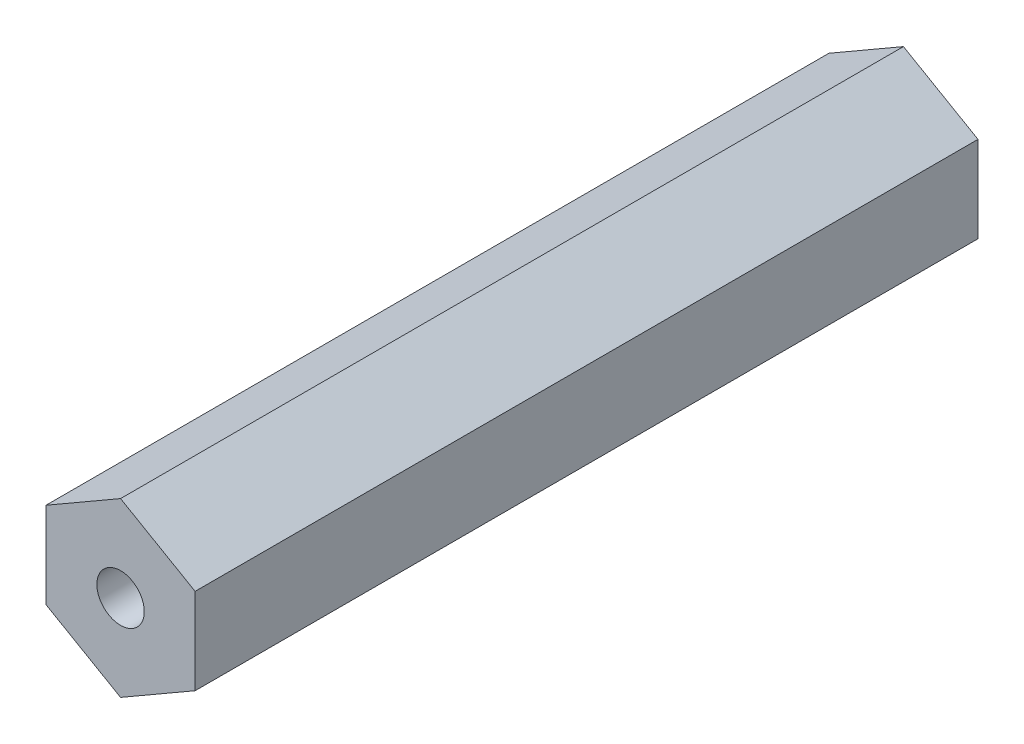
from build123d import *

# Parameters (mm, degrees)
BOSS_EXTRUDE1_DEPTH = 33.3375
SKETCH2_R           = 2.0193
CUT_EXTRUDE1_DEPTH  = 68.376861446


with BuildPart() as part:
    # Sketch1 → Boss-Extrude1 (new, symmetric)
    with BuildSketch(Plane.XY):
        Polygon((0, 7.332348419), (-6.35, 3.666174209), (-6.35, -3.666174209), (0, -7.332348419), (6.35, -3.666174209), (6.35, 3.666174209), align=None)
    extrude(amount=BOSS_EXTRUDE1_DEPTH, both=True)

    # Sketch2 → Cut-Extrude1 (cut, through all)
    with BuildSketch(Plane(origin=(0, 0, -33.3375), x_dir=(-1, 0, 0), z_dir=(0, 0, -1))):
        Circle(SKETCH2_R)
    extrude(amount=-CUT_EXTRUDE1_DEPTH, mode=Mode.SUBTRACT)


solid = part.part
